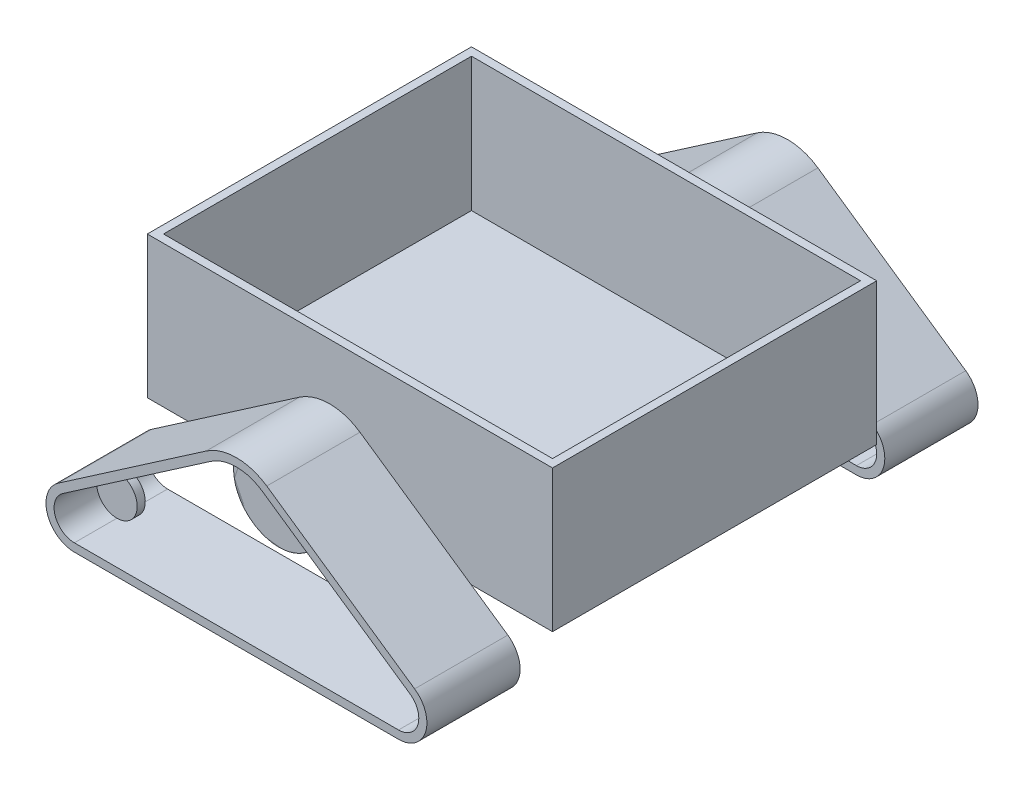
from build123d import *

# Parameters (mm, degrees)
SCHIZZO1_R                     = 25
ESTRUSIONE_ESTRUSIONE1_DEPTH   = 10
ESTRUSIONE_ESTRUSIONE1_2_DEPTH = 10
SCHIZZO1_R_2                   = 56
ESTRUSIONE_ESTRUSIONE1_3_DEPTH = 10
ESTRUSIONE_SOTTILE1_START      = -62.5
ESTRUSIONE_SOTTILE1_DEPTH      = 115
SCHIZZO3_W                     = 500
SCHIZZO3_H                     = 175
ESTRUSIONE_ESTRUSIONE2_DEPTH   = 400
RIPETIZIONE_START              = 565
RIPETIZIONE_A_L1_OUTLINE_R     = 56
RIPETIZIONE_A_L1_DEPTH         = 10
RIPETIZIONE_A_L1_2_OUTLINE_R   = 25
RIPETIZIONE_A_L1_2_DEPTH       = 10
RIPETIZIONE_START_2            = 512.5
RIPETIZIONE_A_L1_3_DEPTH       = 115
RIPETIZIONE_A_L1_4_DEPTH       = 10
SVUOTA1_T                      = -10


# Read off the part's stored shape, not the designer's step: Ripetizione a L1
with BuildPart() as part:
    # Schizzo1 → Estrusione-Estrusione1 (new body)
    with BuildSketch(Plane.XY):
        with Locations((-200, 0)):
            Circle(SCHIZZO1_R)
    extrude(amount=ESTRUSIONE_ESTRUSIONE1_DEPTH)



with BuildPart() as body_2:
    # Schizzo1 → Estrusione-Estrusione1 2 (new body)
    with BuildSketch(Plane.XY):
        with Locations((200, 0)):
            Circle(SCHIZZO1_R)
    extrude(amount=ESTRUSIONE_ESTRUSIONE1_2_DEPTH)


with BuildPart() as body_3:
    # Schizzo1 → Estrusione-Estrusione1 3 (new body)
    with BuildSketch(Plane.XY):
        with Locations((0, 100)):
            Circle(SCHIZZO1_R_2)
    extrude(amount=ESTRUSIONE_ESTRUSIONE1_3_DEPTH)


with BuildPart() as part_1:
    add(part.part)

    add(body_2.part)  # Estrusione-Sottile1 merges body 2

    add(body_3.part)  # Estrusione-Sottile1 merges body 3
    # Schizzo2 → Estrusione-Sottile1 (add)
    with BuildSketch(Plane.XY.offset(10).offset(ESTRUSIONE_SOTTILE1_START)):
        with BuildLine():
            Line((219.84132575, 28.8326515), (37.415071414, 154.370142828))
            ThreePointArc((37.415071414, 154.370142828), (0, 166), (-37.415071414, 154.370142828))
            Line((-37.415071414, 154.370142828), (-219.84132575, 28.8326515))
            ThreePointArc((-219.84132575, 28.8326515), (-233.422618109, -10.388868984), (-200, -35))
            Line((-200, -35), (200, -35))
            ThreePointArc((200, -35), (233.422618109, -10.388868984), (219.84132575, 28.8326515))
        make_face()
        with BuildLine():
            Line((214.172375536, 20.594751071), (31.7461212, 146.132242399))
            ThreePointArc((31.7461212, 146.132242399), (0, 156), (-31.7461212, 146.132242399))
            Line((-31.7461212, 146.132242399), (-214.172375536, 20.594751071))
            ThreePointArc((-214.172375536, 20.594751071), (-223.873298649, -7.420620703), (-200, -25))
            Line((-200, -25), (200, -25))
            ThreePointArc((200, -25), (223.873298649, -7.420620703), (214.172375536, 20.594751071))
        make_face(mode=Mode.SUBTRACT)
    extrude(amount=ESTRUSIONE_SOTTILE1_DEPTH)


with BuildPart() as body_2_2:
    # Schizzo3 → Estrusione-Estrusione2 (new body)
    with BuildSketch(Plane.XY.offset(87.5)):
        with Locations((0, 122.5)):
            Rectangle(SCHIZZO3_W, SCHIZZO3_H)
    extrude(amount=ESTRUSIONE_ESTRUSIONE2_DEPTH)

    # Svuota1
    svuota1_openings = [body_2_2.faces().sort_by_distance(p)[0] for p in [
        (0, 210, 287.5),
    ]]
    offset(amount=SVUOTA1_T, openings=svuota1_openings, kind=Kind.INTERSECTION)


with BuildPart() as body_3_2:
    # Ripetizione a L1 outline → Ripetizione a L1 (new body)
    with BuildSketch(Plane.XY.offset(RIPETIZIONE_START)):
        with Locations((0, 100)):
            Circle(RIPETIZIONE_A_L1_OUTLINE_R)
    extrude(amount=RIPETIZIONE_A_L1_DEPTH)


with BuildPart() as body_4:
    # Ripetizione a L1 2 outline → Ripetizione a L1 2 (new body)
    with BuildSketch(Plane.XY.offset(RIPETIZIONE_START)):
        with Locations((200, 0)):
            Circle(RIPETIZIONE_A_L1_2_OUTLINE_R)
    extrude(amount=RIPETIZIONE_A_L1_2_DEPTH)


with BuildPart() as body_5:
    # Ripetizione a L1 3 outline → Ripetizione a L1 3 (new body)
    with BuildSketch(Plane.XY.offset(RIPETIZIONE_START_2)):
        with BuildLine():
            ThreePointArc((37.415071414, 154.370142828), (0, 166), (-37.415071414, 154.370142828))
            Line((-37.415071414, 154.370142828), (-219.84132575, 28.8326515))
            ThreePointArc((-219.84132575, 28.8326515), (-233.422618109, -10.388868983), (-200, -35))
            Line((-200, -35), (200, -35))
            ThreePointArc((200, -35), (233.422618109, -10.388868983), (219.84132575, 28.8326515))
            Line((219.84132575, 28.8326515), (37.415071414, 154.370142828))
        make_face()
        with BuildLine():
            Line((-214.172375536, 20.594751071), (-31.7461212, 146.132242399))
            ThreePointArc((-31.7461212, 146.132242399), (0, 156), (31.7461212, 146.132242399))
            Line((31.7461212, 146.132242399), (214.172375536, 20.594751071))
            ThreePointArc((214.172375536, 20.594751071), (223.873298649, -7.420620703), (200, -25))
            Line((200, -25), (-200, -25))
            ThreePointArc((-200, -25), (-223.873298649, -7.420620703), (-214.172375536, 20.594751071))
        make_face(mode=Mode.SUBTRACT)
    extrude(amount=RIPETIZIONE_A_L1_3_DEPTH)

    # Ripetizione a L1 4 outline → Ripetizione a L1 4 (add)
    with BuildSketch(Plane.XY.offset(RIPETIZIONE_START)):
        with BuildLine():
            ThreePointArc((31.7461212, 146.132242399), (0, 156), (-31.7461212, 146.132242399))
            ThreePointArc((-31.7461212, 146.132242399), (0, 44), (31.7461212, 146.132242399))
        make_face()
        with BuildLine():
            ThreePointArc((-200, -25), (-176.126701351, 7.420620703), (-214.172375536, 20.594751071))
            ThreePointArc((-214.172375536, 20.594751071), (-223.873298649, -7.420620703), (-200, -25))
        make_face()
        with BuildLine():
            ThreePointArc((200, -25), (223.873298649, -7.420620703), (214.172375536, 20.594751071))
            ThreePointArc((214.172375536, 20.594751071), (176.126701351, 7.420620703), (200, -25))
        make_face()
    extrude(amount=RIPETIZIONE_A_L1_4_DEPTH)


solid = Compound([part_1.part, body_2_2.part, body_3_2.part, body_4.part, body_5.part])
